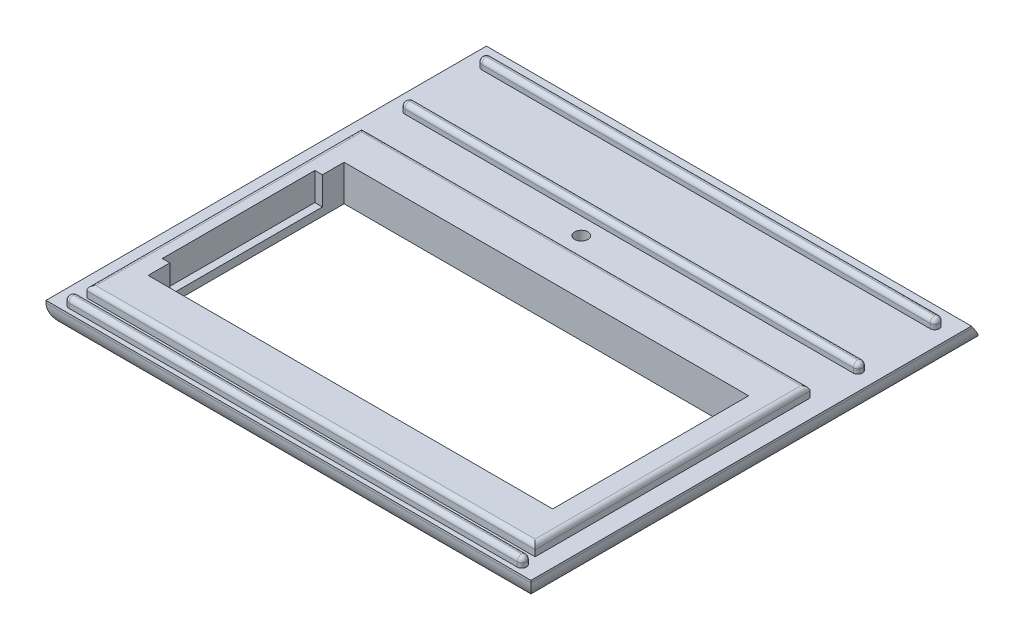
from build123d import *

# Parameters (mm, degrees)
SKETCH1_W           = 105.87
SKETCH1_H           = 82.04
SKETCH1_W_2         = 88.3
SKETCH1_H_2         = 42.78
BOSS_EXTRUDE1_DEPTH = 4
SKETCH1_4_W         = 97.87
SKETCH1_4_H         = 60.01
SKETCH1_4_W_2       = 88.3
SKETCH1_4_H_2       = 42.78
BOSS_EXTRUDE2_DEPTH = 6.35
SKETCH2_R           = 1.449406475
CUT_EXTRUDE1_DEPTH  = 85.876744687
BOSS_EXTRUDE3_DEPTH = 105.87
FILLET6_R           = 1
BOSS_EXTRUDE4_DEPTH = 2
FILLET7_R           = 1
SKETCH5_W           = 1.65
SKETCH5_H           = 33.3
CUT_EXTRUDE3_DEPTH  = 6.08
BOSS_EXTRUDE6_START = 1.5
SKETCH10_W          = 105.87
SKETCH10_H          = 92.304593272
SKETCH10_R          = 1.449406475
SKETCH10_W_2        = 88.3
SKETCH10_H_2        = 42.78
BOSS_EXTRUDE6_DEPTH = 1.5
BOSS_EXTRUDE7_DEPTH = 105.87
FILLET9_R           = 1
FILLET10_R          = 5


with BuildPart() as part:
    # Sketch1 → Boss-Extrude1 (new body)
    with BuildSketch(Plane(origin=(0, 0, 0), x_dir=(1, 0, 0), z_dir=(0, 1, 0))):
        with Locations((15.929638567, -8.187731543)):
            Rectangle(SKETCH1_W, SKETCH1_H)
        with Locations((15.929638567, -14.302731543)):
            Rectangle(SKETCH1_W_2, SKETCH1_H_2, mode=Mode.SUBTRACT)
    extrude(amount=BOSS_EXTRUDE1_DEPTH)

    # Sketch1<4> → Boss-Extrude2 (add)
    with BuildSketch(Plane(origin=(0, 0, 0), x_dir=(1, 0, 0), z_dir=(0, 1, 0))):
        with Locations((15.929638567, -14.302731543)):
            Rectangle(SKETCH1_4_W, SKETCH1_4_H)
        with Locations((15.929638567, -14.302731543)):
            Rectangle(SKETCH1_4_W_2, SKETCH1_4_H_2, mode=Mode.SUBTRACT)
    extrude(amount=BOSS_EXTRUDE2_DEPTH)

    # Sketch2 → Cut-Extrude1 (cut, through all)
    with BuildSketch(Plane.XZ):
        with Locations(Location((9.192630415, -21.45022355, 0), (0, 0, 270))):
            Circle(SKETCH2_R)
    extrude(amount=-CUT_EXTRUDE1_DEPTH, mode=Mode.SUBTRACT)

    # Sketch3 → Boss-Extrude3 (add)
    with BuildSketch(Plane.ZY.offset(37.005361433)):
        Polygon((-32.832268457, 0), (-49.732268457, 0), (-46.932268457, 4), (-32.832268457, 4), align=None)
    extrude(amount=-BOSS_EXTRUDE3_DEPTH)

    # Fillet6
    fillet6_edges = [part.edges().sort_by_distance(p)[0] for p in [
        (-33.005361433, 6.35, 14.302731543),
        (15.929638567, 6.35, 44.307731543),
        (64.864638567, 6.35, 14.302731543),
        (15.929638567, 6.35, -15.702268457),
    ]]
    fillet(fillet6_edges, radius=FILLET6_R)

    # Sketch4 → Boss-Extrude4 (add)
    with BuildSketch(Plane(origin=(0, 4, 0), x_dir=(1, 0, 0), z_dir=(0, 1, 0))):
        with BuildLine():
            Line((64.864638567, 25.152939827), (-33.005361433, 25.152939827))
            ThreePointArc((-33.005361433, 25.152939827), (-34.005361433, 26.152939827), (-33.005361433, 27.152939827))
            Line((-33.005361433, 27.152939827), (64.864638567, 27.152939827))
            ThreePointArc((64.864638567, 27.152939827), (65.864638567, 26.152939827), (64.864638567, 25.152939827))
        make_face()
        with BuildLine():
            Line((-33.005361433, 41.932268457), (64.864638567, 41.932268457))
            ThreePointArc((64.864638567, 41.932268457), (65.864638567, 42.932268457), (64.864638567, 43.932268457))
            Line((64.864638567, 43.932268457), (-33.005361433, 43.932268457))
            ThreePointArc((-33.005361433, 43.932268457), (-34.005361433, 42.932268457), (-33.005361433, 41.932268457))
        make_face()
        with BuildLine():
            Line((64.864638567, -48.207731543), (-33.005361433, -48.207731543))
            ThreePointArc((-33.005361433, -48.207731543), (-34.005361433, -47.207731543), (-33.005361433, -46.207731543))
            Line((-33.005361433, -46.207731543), (64.864638567, -46.207731543))
            ThreePointArc((64.864638567, -46.207731543), (65.864638567, -47.207731543), (64.864638567, -48.207731543))
        make_face()
    extrude(amount=BOSS_EXTRUDE4_DEPTH)

    # Fillet7
    fillet7_edges = [part.edges().sort_by_distance(p)[0] for p in [
        (65.864638567, 6, 47.207731543),
        (15.929638567, 6, 46.207731543),
        (-34.005361433, 6, 47.207731543),
        (15.929638567, 6, 48.207731543),
        (-34.005361433, 6, -42.932268457),
        (15.929638567, 6, -41.932268457),
        (65.864638567, 6, -42.932268457),
        (15.929638567, 6, -43.932268457),
        (65.864638567, 6, -26.152939827),
        (15.929638567, 6, -27.152939827),
        (-34.005361433, 6, -26.152939827),
        (15.929638567, 6, -25.152939827),
    ]]
    fillet(fillet7_edges, radius=FILLET7_R - 0.0001)  # a hair under: the kernel refuses the full size

    # Sketch5 → Cut-Extrude3 (cut)
    with BuildSketch(Plane(origin=(0, 6.35, 0), x_dir=(1, 0, 0), z_dir=(0, 1, 0))):
        with Locations((-29.045361433, -14.302731543)):
            Rectangle(SKETCH5_W, SKETCH5_H)
    extrude(amount=-CUT_EXTRUDE3_DEPTH, mode=Mode.SUBTRACT)

    # Sketch10 → Boss-Extrude6 (add)
    with BuildSketch(Plane.XZ.offset(BOSS_EXTRUDE6_START)):
        with Locations((15.929638567, 3.055434907)):
            Rectangle(SKETCH10_W, SKETCH10_H)
        with Locations(Location((9.192630415, -21.45022355, 0), (0, 0, 270))):
            Circle(SKETCH10_R, mode=Mode.SUBTRACT)
        with Locations((15.929638567, 14.302731543)):
            Rectangle(SKETCH10_W_2, SKETCH10_H_2, mode=Mode.SUBTRACT)
    extrude(amount=-BOSS_EXTRUDE6_DEPTH)

    # Sketch11 → Boss-Extrude7 (add)
    with BuildSketch(Plane.ZY.offset(37.005361433)):
        Polygon((-49.732268457, 0), (-50.782268457, -1.5), (-43.096861729, -1.5), (-43.096861729, 0), align=None)
    extrude(amount=-BOSS_EXTRUDE7_DEPTH)

    # Fillet9
    fillet9_edges = [part.edges().sort_by_distance(p)[0] for p in [
        (9.192630415, -1.5, -20.000817075),
    ]]
    fillet(fillet9_edges, radius=FILLET9_R)

    # Fillet10
    fillet10_edges = [part.edges().sort_by_distance(p)[0] for p in [
        (-37.005361433, -1.5, -0.787268457),
        (68.864638567, -1.5, -0.787268457),
        (15.929638567, -1.5, 49.207731543),
    ]]
    fillet(fillet10_edges, radius=FILLET10_R)


solid = part.part
